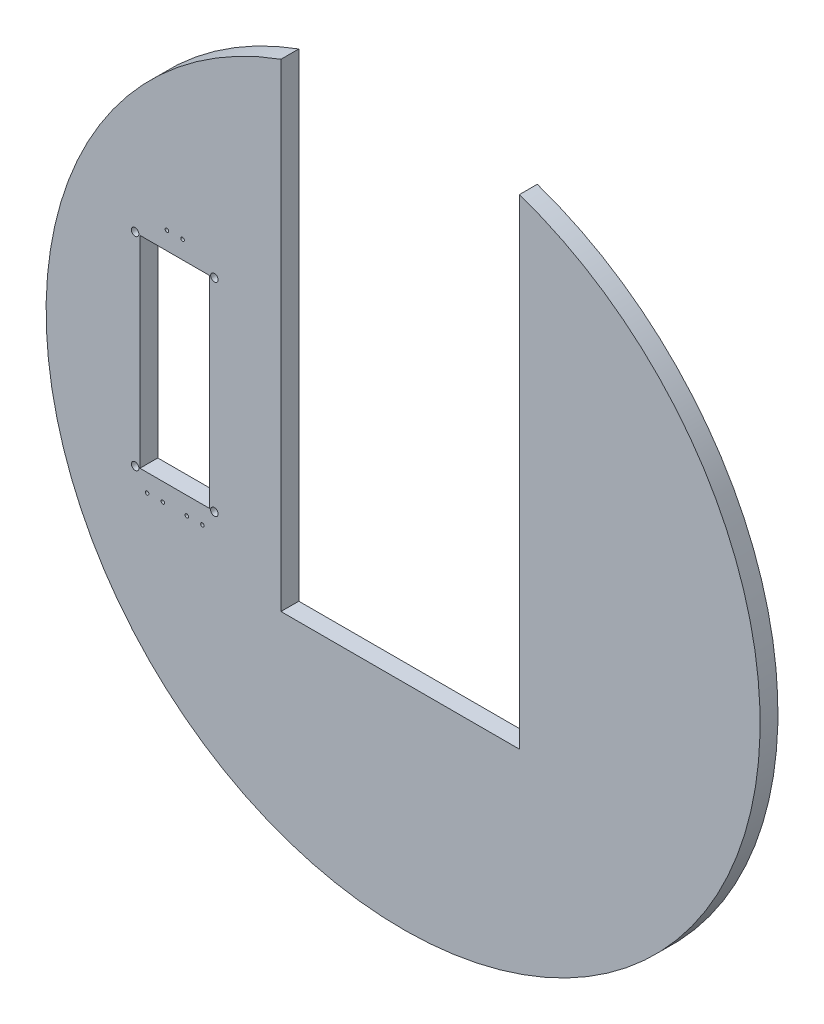
from build123d import *

# Parameters (mm, degrees)
BOSS_EXTRUDE1_DEPTH = 6.35
CUT_EXTRUDE1_REACH  = 209.931
SKETCH2_R           = 1.3335
SKETCH2_W           = 24.765
SKETCH2_H           = 71.755
CUT_EXTRUDE2_REACH  = 209.931
SKETCH3_R           = 0.635


with BuildPart() as part:
    # Sketch1 → Boss-Extrude1 (new body)
    with BuildSketch(Plane.XY):
        with BuildLine():
            Line((41.387169195, 92.71), (41.387169195, -6.35))
            Line((41.387169195, -6.35), (-43.448830805, -6.35))
            Line((-43.448830805, -6.35), (-43.448830805, 92.71))
            Line((-43.448830805, 92.71), (-43.448830805, 163.786495263))
            ThreePointArc((-43.448830805, 163.786495263), (1.093639987, -82.545291061), (41.387169195, 164.517073863))
            Line((41.387169195, 164.517073863), (41.387169195, 92.71))
        make_face()
    extrude(amount=BOSS_EXTRUDE1_DEPTH)

    # Sketch2 → Cut-Extrude1 (cut, up to next)
    with BuildSketch(Plane(origin=(0, 0, 0), x_dir=(-1, 0, 0), z_dir=(0, 0, -1)), mode=Mode.PRIVATE) as cut_extrude1_sk1:
        with Locations((67.134330805, 12.5095)):
            Circle(SKETCH2_R)
    cut_extrude1_tool1 = extrude(cut_extrude1_sk1.sketch, amount=-CUT_EXTRUDE1_REACH, mode=Mode.PRIVATE) & part.part
    # Sketch2 → Cut-Extrude1 (cut, up to next)
    with BuildSketch(Plane(origin=(0, 0, 0), x_dir=(-1, 0, 0), z_dir=(0, 0, -1)), mode=Mode.PRIVATE) as cut_extrude1_sk2:
        with Locations((67.134330805, 84.6455)):
            Circle(SKETCH2_R)
    cut_extrude1_tool2 = extrude(cut_extrude1_sk2.sketch, amount=-CUT_EXTRUDE1_REACH, mode=Mode.PRIVATE) & part.part
    # Sketch2 → Cut-Extrude1 (cut, up to next)
    with BuildSketch(Plane(origin=(0, 0, 0), x_dir=(-1, 0, 0), z_dir=(0, 0, -1)), mode=Mode.PRIVATE) as cut_extrude1_sk3:
        with Locations((95.328330805, 84.6455)):
            Circle(SKETCH2_R)
    cut_extrude1_tool3 = extrude(cut_extrude1_sk3.sketch, amount=-CUT_EXTRUDE1_REACH, mode=Mode.PRIVATE) & part.part
    # Sketch2 → Cut-Extrude1 (cut, up to next)
    with BuildSketch(Plane(origin=(0, 0, 0), x_dir=(-1, 0, 0), z_dir=(0, 0, -1)), mode=Mode.PRIVATE) as cut_extrude1_sk4:
        with Locations((95.328330805, 12.5095)):
            Circle(SKETCH2_R)
    cut_extrude1_tool4 = extrude(cut_extrude1_sk4.sketch, amount=-CUT_EXTRUDE1_REACH, mode=Mode.PRIVATE) & part.part
    # Sketch2 → Cut-Extrude1 (cut, up to next)
    with BuildSketch(Plane(origin=(0, 0, 0), x_dir=(-1, 0, 0), z_dir=(0, 0, -1)), mode=Mode.PRIVATE) as cut_extrude1_sk5:
        with Locations((81.231330805, 48.5775)):
            Rectangle(SKETCH2_W, SKETCH2_H)
    cut_extrude1_tool5 = extrude(cut_extrude1_sk5.sketch, amount=-CUT_EXTRUDE1_REACH, mode=Mode.PRIVATE) & part.part
    add(cut_extrude1_tool1.solids().sort_by_distance((-67.134331, 12.5095, 0))[0], mode=Mode.SUBTRACT)
    add(cut_extrude1_tool2.solids().sort_by_distance((-67.134331, 84.6455, 0))[0], mode=Mode.SUBTRACT)
    add(cut_extrude1_tool3.solids().sort_by_distance((-95.328331, 84.6455, 0))[0], mode=Mode.SUBTRACT)
    add(cut_extrude1_tool4.solids().sort_by_distance((-95.328331, 12.5095, 0))[0], mode=Mode.SUBTRACT)
    add(cut_extrude1_tool5.solids().sort_by_distance((-81.231331, 48.5775, 0))[0], mode=Mode.SUBTRACT)

    # Sketch3 → Cut-Extrude2 (cut, up to next)
    with BuildSketch(Plane.XY.offset(6.35), mode=Mode.PRIVATE) as cut_extrude2_sk1:
        with Locations((-71.388830805, 6.35)):
            Circle(SKETCH3_R)
    cut_extrude2_tool1 = extrude(cut_extrude2_sk1.sketch, amount=-CUT_EXTRUDE2_REACH, mode=Mode.PRIVATE) & part.part
    # Sketch3 → Cut-Extrude2 (cut, up to next)
    with BuildSketch(Plane.XY.offset(6.35), mode=Mode.PRIVATE) as cut_extrude2_sk2:
        with Locations((-76.976830805, 6.35)):
            Circle(SKETCH3_R)
    cut_extrude2_tool2 = extrude(cut_extrude2_sk2.sketch, amount=-CUT_EXTRUDE2_REACH, mode=Mode.PRIVATE) & part.part
    # Sketch3 → Cut-Extrude2 (cut, up to next)
    with BuildSketch(Plane.XY.offset(6.35), mode=Mode.PRIVATE) as cut_extrude2_sk3:
        with Locations((-85.485830805, 6.35)):
            Circle(SKETCH3_R)
    cut_extrude2_tool3 = extrude(cut_extrude2_sk3.sketch, amount=-CUT_EXTRUDE2_REACH, mode=Mode.PRIVATE) & part.part
    # Sketch3 → Cut-Extrude2 (cut, up to next)
    with BuildSketch(Plane.XY.offset(6.35), mode=Mode.PRIVATE) as cut_extrude2_sk4:
        with Locations((-91.073830805, 6.35)):
            Circle(SKETCH3_R)
    cut_extrude2_tool4 = extrude(cut_extrude2_sk4.sketch, amount=-CUT_EXTRUDE2_REACH, mode=Mode.PRIVATE) & part.part
    # Sketch3 → Cut-Extrude2 (cut, up to next)
    with BuildSketch(Plane.XY.offset(6.35), mode=Mode.PRIVATE) as cut_extrude2_sk5:
        with Locations((-78.437330805, 90.805)):
            Circle(SKETCH3_R)
    cut_extrude2_tool5 = extrude(cut_extrude2_sk5.sketch, amount=-CUT_EXTRUDE2_REACH, mode=Mode.PRIVATE) & part.part
    # Sketch3 → Cut-Extrude2 (cut, up to next)
    with BuildSketch(Plane.XY.offset(6.35), mode=Mode.PRIVATE) as cut_extrude2_sk6:
        with Locations((-84.025330805, 90.805)):
            Circle(SKETCH3_R)
    cut_extrude2_tool6 = extrude(cut_extrude2_sk6.sketch, amount=-CUT_EXTRUDE2_REACH, mode=Mode.PRIVATE) & part.part
    add(cut_extrude2_tool1.solids().sort_by_distance((-71.388831, 6.35, 6.35))[0], mode=Mode.SUBTRACT)
    add(cut_extrude2_tool2.solids().sort_by_distance((-76.976831, 6.35, 6.35))[0], mode=Mode.SUBTRACT)
    add(cut_extrude2_tool3.solids().sort_by_distance((-85.485831, 6.35, 6.35))[0], mode=Mode.SUBTRACT)
    add(cut_extrude2_tool4.solids().sort_by_distance((-91.073831, 6.35, 6.35))[0], mode=Mode.SUBTRACT)
    add(cut_extrude2_tool5.solids().sort_by_distance((-78.437331, 90.805, 6.35))[0], mode=Mode.SUBTRACT)
    add(cut_extrude2_tool6.solids().sort_by_distance((-84.025331, 90.805, 6.35))[0], mode=Mode.SUBTRACT)


solid = part.part
